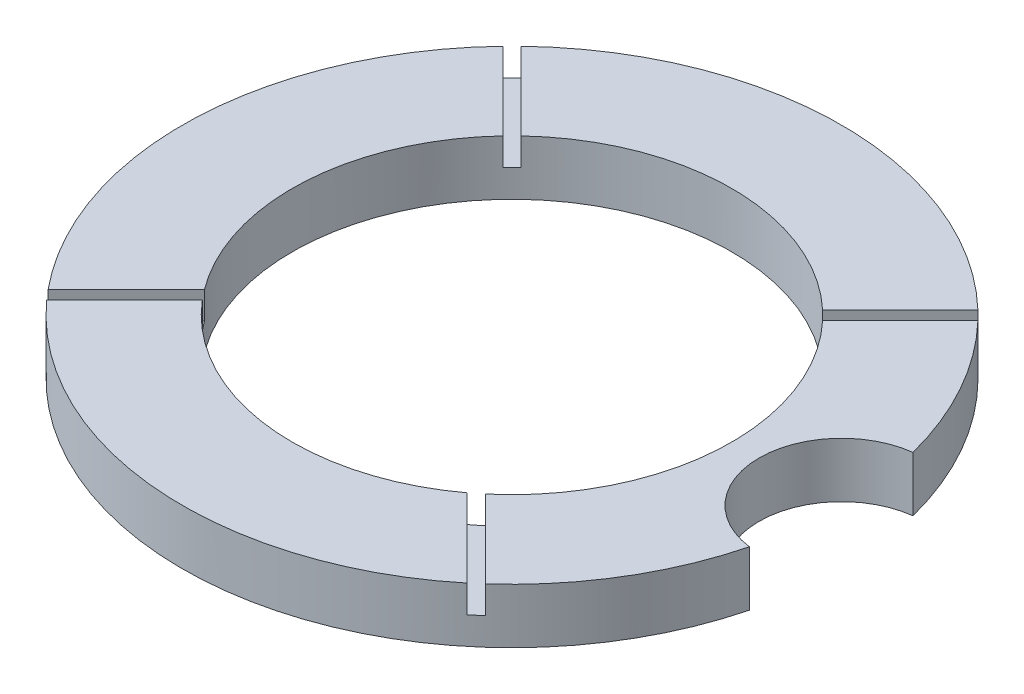
from build123d import *

# Parameters (mm, degrees)
SKETCH1_R           = 76.1746
BOSS_EXTRUDE1_DEPTH = 12.7
SKETCH1_10_R        = 50.8
CUT_EXTRUDE2_DEPTH  = 109.473173505
CUT_EXTRUDE3_DEPTH  = 109.473173505
CUT_EXTRUDE4_DEPTH  = 6.35


with BuildPart() as part:
    # Sketch1 → Boss-Extrude1 (new body)
    with BuildSketch(Plane(origin=(0, 0, 0), x_dir=(1, 0, 0), z_dir=(0, 1, 0))):
        Circle(SKETCH1_R)
    extrude(amount=BOSS_EXTRUDE1_DEPTH)

    # Sketch1<10> → Cut-Extrude2 (cut, through all)
    with BuildSketch(Plane(origin=(0, 0, 0), x_dir=(1, 0, 0), z_dir=(0, 1, 0))):
        Circle(SKETCH1_10_R)
    extrude(amount=CUT_EXTRUDE2_DEPTH, mode=Mode.SUBTRACT)

    # Sketch2 → Cut-Extrude3 (cut, through all)
    with BuildSketch(Plane(origin=(0, 12.7, 0), x_dir=(1, 0, 0), z_dir=(0, 1, 0))):
        with BuildLine():
            Line((76.2, 19.05), (76.2, -19.05))
            ThreePointArc((76.2, -19.05), (57.124583067, 0), (76.2, 19.05))
        make_face()
    extrude(amount=-CUT_EXTRUDE3_DEPTH, mode=Mode.SUBTRACT)

    # Sketch3 → Cut-Extrude4 (cut)
    with BuildSketch(Plane(origin=(0, 12.7, 0), x_dir=(1, 0, 0), z_dir=(0, 1, 0))):
        Polygon((-31.973255589, 29.853915145), (-29.853915145, 31.973255589), (-57.811345109, 59.930685554), (-59.930685554, 57.811345109), align=None)
        Polygon((27.85131803, 25.731977585), (55.808747994, 53.689407549), (53.689407549, 55.808747994), (25.731977585, 27.85131803), align=None)
        Polygon((21.610040026, -31.973255589), (49.56746999, -59.930685554), (51.686810434, -57.811345109), (23.72938047, -29.853915145), align=None)
        Polygon((-36.095193149, -25.731977585), (-64.052623113, -53.689407549), (-61.933282669, -55.808747994), (-33.975852704, -27.85131803), align=None)
    extrude(amount=-CUT_EXTRUDE4_DEPTH, mode=Mode.SUBTRACT)


solid = part.part
